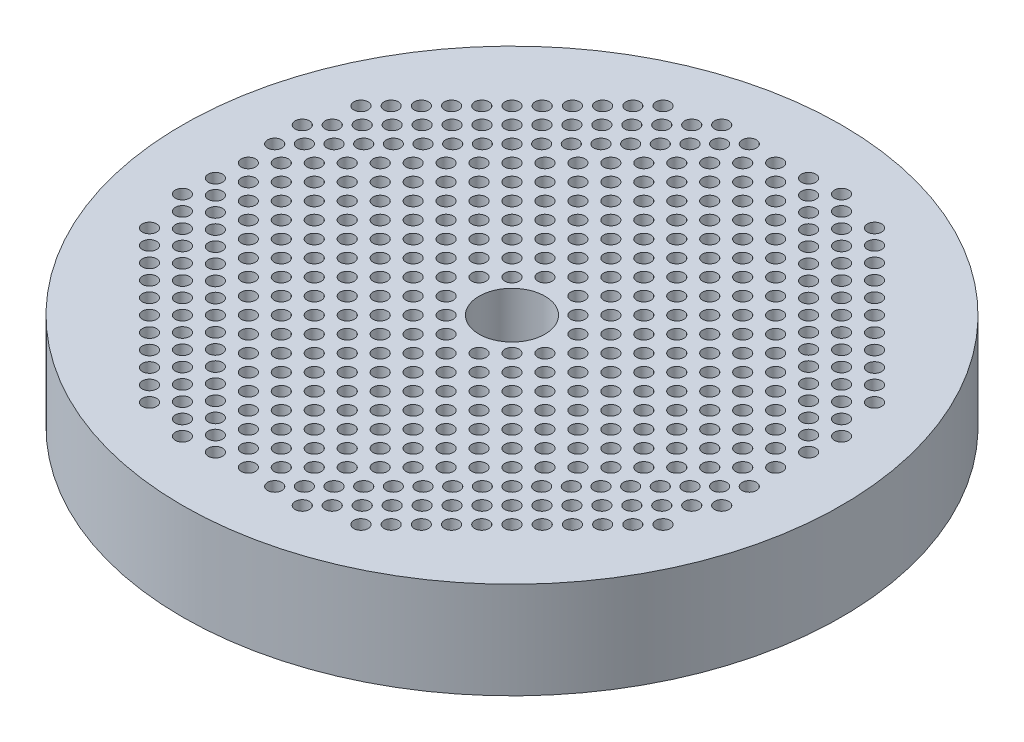
from build123d import *

# Parameters (mm, degrees)
SKETCH1_R               = 150
BOSS_EXTRUDE2_DEPTH     = 22
FILL_START              = -22
FILL_PATTERN1_OUTLINE_R = 3.25
FILL_PATTERN1_DEPTH     = 44


# Read off the part's stored shape, not the designer's step: Fill Pattern1
with BuildPart() as part:
    # Sketch1 → Boss-Extrude2 (new, symmetric)
    # profile 1 of 3: a face of its own
    with BuildSketch(Plane(origin=(0, 0, 0), x_dir=(1, 0, 0), z_dir=(0, 1, 0))):
        with Locations(Location((0, 0, 0), (0, 0, 270))):
            Circle(SKETCH1_R)
        with BuildLine():
            Line((0, -18.3), (-5, -18.3))
            Line((-5, -18.3), (-5, -14.142135623730951))
            ThreePointArc((-5.000000000000001, -14.142135623730951), (-8.660254037844386, 12.24744871391589), (15, 0))
            ThreePointArc((15, -3.67e-15), (12.247448713915892, -8.660254037844384), (4.999999999999996, -14.142135623730953))
            Line((5, -14.142135623730951), (5, -18.3))
            Line((5, -18.3), (0, -18.3))
        make_face(mode=Mode.SUBTRACT)
    # profile 2 of 3: a face of its own
    with BuildSketch(Plane(origin=(0, 0, 0), x_dir=(1, 0, 0), z_dir=(0, 1, 0))):
        with BuildLine():
            Line((0, -15), (0, -18.3))
            Line((0, -18.3), (5, -18.3))
            Line((5, -18.3), (5, -14.142135623730951))
            ThreePointArc((4.999999999999996, -14.142135623730953), (2.5365296808862734, -14.78397839480236), (-3.4915e-13, -15))
        make_face()
    # profile 3 of 3: a face of its own
    with BuildSketch(Plane(origin=(0, 0, 0), x_dir=(1, 0, 0), z_dir=(0, 1, 0))):
        with BuildLine():
            Line((-5, -14.142135623730951), (-5, -18.3))
            Line((-5, -18.3), (0, -18.3))
            Line((0, -18.3), (0, -15))
            ThreePointArc((-3.4915e-13, -15), (-2.5365296808866202, -14.7839783948023), (-5.000000000000001, -14.142135623730951))
        make_face()
    extrude(amount=BOSS_EXTRUDE2_DEPTH, both=True)

    # Fill Pattern1 outline → Fill Pattern1 (cut)
    with BuildSketch(Plane(origin=(0, 0, 0), x_dir=(1, 0, 0), z_dir=(0, 1, 0)).offset(FILL_START)):
        with Locations((0, -29.999996932)):
            Circle(FILL_PATTERN1_OUTLINE_R)
        with Locations((7.5, -82.499996932)):
            Circle(FILL_PATTERN1_OUTLINE_R)
        with Locations((40.5, 94.500003068)):
            Circle(FILL_PATTERN1_OUTLINE_R)
        with Locations((105, 15.000003068)):
            Circle(FILL_PATTERN1_OUTLINE_R)
        with Locations((75, -29.999996932)):
            Circle(FILL_PATTERN1_OUTLINE_R)
        with Locations((15, -74.999996932)):
            Circle(FILL_PATTERN1_OUTLINE_R)
        with Locations((33.75, 101.250003068)):
            Circle(FILL_PATTERN1_OUTLINE_R)
        with Locations((97.5, 22.500003068)):
            Circle(FILL_PATTERN1_OUTLINE_R)
        with Locations((82.5, -22.499996932)):
            Circle(FILL_PATTERN1_OUTLINE_R)
        with Locations((120, 3.068e-06)):
            Circle(FILL_PATTERN1_OUTLINE_R)
        with Locations((54, 81.000003068)):
            Circle(FILL_PATTERN1_OUTLINE_R)
        with Locations((27.272727273, 122.727275795)):
            Circle(FILL_PATTERN1_OUTLINE_R)
        with Locations((52.5, -52.499996932)):
            Circle(FILL_PATTERN1_OUTLINE_R)
        with Locations((60, -44.999996932)):
            Circle(FILL_PATTERN1_OUTLINE_R)
        with Locations((47.25, 87.750003068)):
            Circle(FILL_PATTERN1_OUTLINE_R)
        with Locations((112.5, 7.500003068)):
            Circle(FILL_PATTERN1_OUTLINE_R)
        with Locations((67.5, -37.499996932)):
            Circle(FILL_PATTERN1_OUTLINE_R)
        with Locations((37.5, -52.499996932)):
            Circle(FILL_PATTERN1_OUTLINE_R)
        with Locations((13.5, 121.500003068)):
            Circle(FILL_PATTERN1_OUTLINE_R)
        with Locations((75, 45.000003068)):
            Circle(FILL_PATTERN1_OUTLINE_R)
        with Locations((105, 3.068e-06)):
            Circle(FILL_PATTERN1_OUTLINE_R)
        with Locations((45, -44.999996932)):
            Circle(FILL_PATTERN1_OUTLINE_R)
        with Locations((-48.125, 116.875003068)):
            Circle(FILL_PATTERN1_OUTLINE_R)
        with Locations((67.5, 52.500003068)):
            Circle(FILL_PATTERN1_OUTLINE_R)
        with Locations((97.5, 7.500003068)):
            Circle(FILL_PATTERN1_OUTLINE_R)
        with Locations((22.5, -67.499996932)):
            Circle(FILL_PATTERN1_OUTLINE_R)
        with Locations((27, 108.000003068)):
            Circle(FILL_PATTERN1_OUTLINE_R)
        with Locations((90, 30.000003068)):
            Circle(FILL_PATTERN1_OUTLINE_R)
        with Locations((90, -14.999996932)):
            Circle(FILL_PATTERN1_OUTLINE_R)
        with Locations((30, -59.999996932)):
            Circle(FILL_PATTERN1_OUTLINE_R)
        with Locations((20.25, 114.750003068)):
            Circle(FILL_PATTERN1_OUTLINE_R)
        with Locations((82.5, 37.500003068)):
            Circle(FILL_PATTERN1_OUTLINE_R)
        with Locations((97.5, -7.499996932)):
            Circle(FILL_PATTERN1_OUTLINE_R)
        with Locations((7.5, -97.499996932)):
            Circle(FILL_PATTERN1_OUTLINE_R)
        with Locations((68.181818182, 81.818184886)):
            Circle(FILL_PATTERN1_OUTLINE_R)
        with Locations((94.5, 40.500003068)):
            Circle(FILL_PATTERN1_OUTLINE_R)
        with Locations((75, -44.999996932)):
            Circle(FILL_PATTERN1_OUTLINE_R)
        with Locations((15, -89.999996932)):
            Circle(FILL_PATTERN1_OUTLINE_R)
        with Locations((61.363636364, 88.636366705)):
            Circle(FILL_PATTERN1_OUTLINE_R)
        with Locations((87.75, 47.250003068)):
            Circle(FILL_PATTERN1_OUTLINE_R)
        with Locations((82.5, -37.499996932)):
            Circle(FILL_PATTERN1_OUTLINE_R)
        with Locations((55, 110.000003068)):
            Circle(FILL_PATTERN1_OUTLINE_R)
        with Locations((81.818181818, 68.18182125)):
            Circle(FILL_PATTERN1_OUTLINE_R)
        with Locations((108, 27.000003068)):
            Circle(FILL_PATTERN1_OUTLINE_R)
        with Locations((60, -59.999996932)):
            Circle(FILL_PATTERN1_OUTLINE_R)
        with Locations((48.125, 116.875003068)):
            Circle(FILL_PATTERN1_OUTLINE_R)
        with Locations((75, 75.000003068)):
            Circle(FILL_PATTERN1_OUTLINE_R)
        with Locations((101.25, 33.750003068)):
            Circle(FILL_PATTERN1_OUTLINE_R)
        with Locations((67.5, -52.499996932)):
            Circle(FILL_PATTERN1_OUTLINE_R)
        with Locations((37.5, -67.499996932)):
            Circle(FILL_PATTERN1_OUTLINE_R)
        with Locations((40.909090909, 109.090912159)):
            Circle(FILL_PATTERN1_OUTLINE_R)
        with Locations((67.5, 67.500003068)):
            Circle(FILL_PATTERN1_OUTLINE_R)
        with Locations((105, -14.999996932)):
            Circle(FILL_PATTERN1_OUTLINE_R)
        with Locations((45, -59.999996932)):
            Circle(FILL_PATTERN1_OUTLINE_R)
        with Locations((34.090909091, 115.909093977)):
            Circle(FILL_PATTERN1_OUTLINE_R)
        with Locations((60.75, 74.250003068)):
            Circle(FILL_PATTERN1_OUTLINE_R)
        with Locations((112.5, -7.499996932)):
            Circle(FILL_PATTERN1_OUTLINE_R)
        with Locations((22.5, -82.499996932)):
            Circle(FILL_PATTERN1_OUTLINE_R)
        with Locations((54.545454545, 95.454548523)):
            Circle(FILL_PATTERN1_OUTLINE_R)
        with Locations((81, 54.000003068)):
            Circle(FILL_PATTERN1_OUTLINE_R)
        with Locations((90, -29.999996932)):
            Circle(FILL_PATTERN1_OUTLINE_R)
        with Locations((30, -74.999996932)):
            Circle(FILL_PATTERN1_OUTLINE_R)
        with Locations((47.727272727, 102.272730341)):
            Circle(FILL_PATTERN1_OUTLINE_R)
        with Locations((74.25, 60.750003068)):
            Circle(FILL_PATTERN1_OUTLINE_R)
        with Locations((97.5, -22.499996932)):
            Circle(FILL_PATTERN1_OUTLINE_R)
        with Locations((45, 60.000003068)):
            Circle(FILL_PATTERN1_OUTLINE_R)
        with Locations((75, 15.000003068)):
            Circle(FILL_PATTERN1_OUTLINE_R)
        with Locations((45, -29.999996932)):
            Circle(FILL_PATTERN1_OUTLINE_R)
        with Locations((-103.125, 61.875003068)):
            Circle(FILL_PATTERN1_OUTLINE_R)
        with Locations((15, 105.000003068)):
            Circle(FILL_PATTERN1_OUTLINE_R)
        with Locations((-40.5, 94.500003068)):
            Circle(FILL_PATTERN1_OUTLINE_R)
        with Locations((-68.181818182, 81.818184886)):
            Circle(FILL_PATTERN1_OUTLINE_R)
        with Locations((-96.25, 68.750003068)):
            Circle(FILL_PATTERN1_OUTLINE_R)
        with Locations((30, -44.999996932)):
            Circle(FILL_PATTERN1_OUTLINE_R)
        with Locations((-89.375, 75.625003068)):
            Circle(FILL_PATTERN1_OUTLINE_R)
        with Locations((-61.363636364, 88.636366705)):
            Circle(FILL_PATTERN1_OUTLINE_R)
        with Locations((-33.75, 101.250003068)):
            Circle(FILL_PATTERN1_OUTLINE_R)
        with Locations((22.5, 97.500003068)):
            Circle(FILL_PATTERN1_OUTLINE_R)
        with Locations((52.5, 52.500003068)):
            Circle(FILL_PATTERN1_OUTLINE_R)
        with Locations((82.5, 7.500003068)):
            Circle(FILL_PATTERN1_OUTLINE_R)
        with Locations((37.5, -37.499996932)):
            Circle(FILL_PATTERN1_OUTLINE_R)
        with Locations((-54, 81.000003068)):
            Circle(FILL_PATTERN1_OUTLINE_R)
        with Locations((0, 120.000003068)):
            Circle(FILL_PATTERN1_OUTLINE_R)
        with Locations((30, 75.000003068)):
            Circle(FILL_PATTERN1_OUTLINE_R)
        with Locations((60, 30.000003068)):
            Circle(FILL_PATTERN1_OUTLINE_R)
        with Locations((60, -14.999996932)):
            Circle(FILL_PATTERN1_OUTLINE_R)
        with Locations((-116.875, 48.125003068)):
            Circle(FILL_PATTERN1_OUTLINE_R)
        with Locations((-88.636363636, 61.363639432)):
            Circle(FILL_PATTERN1_OUTLINE_R)
        with Locations((-60.75, 74.250003068)):
            Circle(FILL_PATTERN1_OUTLINE_R)
        with Locations((-75, 75.000003068)):
            Circle(FILL_PATTERN1_OUTLINE_R)
        with Locations((-47.25, 87.750003068)):
            Circle(FILL_PATTERN1_OUTLINE_R)
        with Locations((7.5, 112.500003068)):
            Circle(FILL_PATTERN1_OUTLINE_R)
        with Locations((37.5, 67.500003068)):
            Circle(FILL_PATTERN1_OUTLINE_R)
        with Locations((67.5, 22.500003068)):
            Circle(FILL_PATTERN1_OUTLINE_R)
        with Locations((52.5, -22.499996932)):
            Circle(FILL_PATTERN1_OUTLINE_R)
        with Locations((-110, 55.000003068)):
            Circle(FILL_PATTERN1_OUTLINE_R)
        with Locations((-81.818181818, 68.18182125)):
            Circle(FILL_PATTERN1_OUTLINE_R)
        with Locations((45, 75.000003068)):
            Circle(FILL_PATTERN1_OUTLINE_R)
        with Locations((-13.5, 121.500003068)):
            Circle(FILL_PATTERN1_OUTLINE_R)
        with Locations((-40.909090909, 109.090912159)):
            Circle(FILL_PATTERN1_OUTLINE_R)
        with Locations((-68.75, 96.250003068)):
            Circle(FILL_PATTERN1_OUTLINE_R)
        with Locations((7.5, -67.499996932)):
            Circle(FILL_PATTERN1_OUTLINE_R)
        with Locations((67.5, -22.499996932)):
            Circle(FILL_PATTERN1_OUTLINE_R)
        with Locations((82.5, 22.500003068)):
            Circle(FILL_PATTERN1_OUTLINE_R)
        with Locations((52.5, 67.500003068)):
            Circle(FILL_PATTERN1_OUTLINE_R)
        with Locations((60, 60.000003068)):
            Circle(FILL_PATTERN1_OUTLINE_R)
        with Locations((-27.272727273, 122.727275795)):
            Circle(FILL_PATTERN1_OUTLINE_R)
        with Locations((-55, 110.000003068)):
            Circle(FILL_PATTERN1_OUTLINE_R)
        with Locations((52.5, -37.499996932)):
            Circle(FILL_PATTERN1_OUTLINE_R)
        with Locations((90, 15.000003068)):
            Circle(FILL_PATTERN1_OUTLINE_R)
        with Locations((60, -29.999996932)):
            Circle(FILL_PATTERN1_OUTLINE_R)
        with Locations((-61.875, 103.125003068)):
            Circle(FILL_PATTERN1_OUTLINE_R)
        with Locations((-34.090909091, 115.909093977)):
            Circle(FILL_PATTERN1_OUTLINE_R)
        with Locations((82.5, -7.499996932)):
            Circle(FILL_PATTERN1_OUTLINE_R)
        with Locations((22.5, -52.499996932)):
            Circle(FILL_PATTERN1_OUTLINE_R)
        with Locations((-82.5, 82.500003068)):
            Circle(FILL_PATTERN1_OUTLINE_R)
        with Locations((-54.545454545, 95.454548523)):
            Circle(FILL_PATTERN1_OUTLINE_R)
        with Locations((-27, 108.000003068)):
            Circle(FILL_PATTERN1_OUTLINE_R)
        with Locations((30, 90.000003068)):
            Circle(FILL_PATTERN1_OUTLINE_R)
        with Locations((60, 45.000003068)):
            Circle(FILL_PATTERN1_OUTLINE_R)
        with Locations((90, 3.068e-06)):
            Circle(FILL_PATTERN1_OUTLINE_R)
        with Locations((75, 30.000003068)):
            Circle(FILL_PATTERN1_OUTLINE_R)
        with Locations((75, -14.999996932)):
            Circle(FILL_PATTERN1_OUTLINE_R)
        with Locations((15, -59.999996932)):
            Circle(FILL_PATTERN1_OUTLINE_R)
        with Locations((-75.625, 89.375003068)):
            Circle(FILL_PATTERN1_OUTLINE_R)
        with Locations((-47.727272727, 102.272730341)):
            Circle(FILL_PATTERN1_OUTLINE_R)
        with Locations((-20.25, 114.750003068)):
            Circle(FILL_PATTERN1_OUTLINE_R)
        with Locations((37.5, 82.500003068)):
            Circle(FILL_PATTERN1_OUTLINE_R)
        with Locations((67.5, 37.500003068)):
            Circle(FILL_PATTERN1_OUTLINE_R)
        with Locations((48.125, -116.874996932)):
            Circle(FILL_PATTERN1_OUTLINE_R)
        with Locations((55, -109.999996932)):
            Circle(FILL_PATTERN1_OUTLINE_R)
        with Locations((61.875, -103.124996932)):
            Circle(FILL_PATTERN1_OUTLINE_R)
        with Locations((103.125, 61.875003068)):
            Circle(FILL_PATTERN1_OUTLINE_R)
        with Locations((114.75, -20.249996932)):
            Circle(FILL_PATTERN1_OUTLINE_R)
        with Locations((7.5, -112.499996932)):
            Circle(FILL_PATTERN1_OUTLINE_R)
        with Locations((96.25, 68.750003068)):
            Circle(FILL_PATTERN1_OUTLINE_R)
        with Locations((122.727272727, 27.272730341)):
            Circle(FILL_PATTERN1_OUTLINE_R)
        with Locations((121.5, -13.499996932)):
            Circle(FILL_PATTERN1_OUTLINE_R)
        with Locations((15, -104.999996932)):
            Circle(FILL_PATTERN1_OUTLINE_R)
        with Locations((89.375, 75.625003068)):
            Circle(FILL_PATTERN1_OUTLINE_R)
        with Locations((116.875, 48.125003068)):
            Circle(FILL_PATTERN1_OUTLINE_R)
        with Locations((101.25, -33.749996932)):
            Circle(FILL_PATTERN1_OUTLINE_R)
        with Locations((110, 55.000003068)):
            Circle(FILL_PATTERN1_OUTLINE_R)
        with Locations((108, -26.999996932)):
            Circle(FILL_PATTERN1_OUTLINE_R)
        with Locations((94.5, -40.499996932)):
            Circle(FILL_PATTERN1_OUTLINE_R)
        with Locations((87.75, -47.249996932)):
            Circle(FILL_PATTERN1_OUTLINE_R)
        with Locations((81, -53.999996932)):
            Circle(FILL_PATTERN1_OUTLINE_R)
        with Locations((74.25, -60.749996932)):
            Circle(FILL_PATTERN1_OUTLINE_R)
        with Locations((68.75, 96.250003068)):
            Circle(FILL_PATTERN1_OUTLINE_R)
        with Locations((95.454545455, 54.545457614)):
            Circle(FILL_PATTERN1_OUTLINE_R)
        with Locations((121.5, 13.500003068)):
            Circle(FILL_PATTERN1_OUTLINE_R)
        with Locations((45, -74.999996932)):
            Circle(FILL_PATTERN1_OUTLINE_R)
        with Locations((61.875, 103.125003068)):
            Circle(FILL_PATTERN1_OUTLINE_R)
        with Locations((88.636363636, 61.363639432)):
            Circle(FILL_PATTERN1_OUTLINE_R)
        with Locations((114.75, 20.250003068)):
            Circle(FILL_PATTERN1_OUTLINE_R)
        with Locations((52.5, -67.499996932)):
            Circle(FILL_PATTERN1_OUTLINE_R)
        with Locations((115.909090909, 34.090912159)):
            Circle(FILL_PATTERN1_OUTLINE_R)
        with Locations((22.5, -97.499996932)):
            Circle(FILL_PATTERN1_OUTLINE_R)
        with Locations((82.5, 82.500003068)):
            Circle(FILL_PATTERN1_OUTLINE_R)
        with Locations((109.090909091, 40.909093977)):
            Circle(FILL_PATTERN1_OUTLINE_R)
        with Locations((37.5, -82.499996932)):
            Circle(FILL_PATTERN1_OUTLINE_R)
        with Locations((102.272727273, 47.727275795)):
            Circle(FILL_PATTERN1_OUTLINE_R)
        with Locations((75.625, 89.375003068)):
            Circle(FILL_PATTERN1_OUTLINE_R)
        with Locations((30, -89.999996932)):
            Circle(FILL_PATTERN1_OUTLINE_R)
        with Locations((54.545454545, -95.454542386)):
            Circle(FILL_PATTERN1_OUTLINE_R)
        with Locations((110, -54.999996932)):
            Circle(FILL_PATTERN1_OUTLINE_R)
        with Locations((47.727272727, -102.272724205)):
            Circle(FILL_PATTERN1_OUTLINE_R)
        with Locations((103.125, -61.874996932)):
            Circle(FILL_PATTERN1_OUTLINE_R)
        with Locations((13.5, -121.499996932)):
            Circle(FILL_PATTERN1_OUTLINE_R)
        with Locations((68.181818182, -81.81817875)):
            Circle(FILL_PATTERN1_OUTLINE_R)
        with Locations((61.363636364, -88.636360568)):
            Circle(FILL_PATTERN1_OUTLINE_R)
        with Locations((116.875, -48.124996932)):
            Circle(FILL_PATTERN1_OUTLINE_R)
        with Locations((27.272727273, -122.727269659)):
            Circle(FILL_PATTERN1_OUTLINE_R)
        with Locations((82.5, -82.499996932)):
            Circle(FILL_PATTERN1_OUTLINE_R)
        with Locations((75.625, -89.374996932)):
            Circle(FILL_PATTERN1_OUTLINE_R)
        with Locations((68.75, -96.249996932)):
            Circle(FILL_PATTERN1_OUTLINE_R)
        with Locations((40.909090909, -109.090906023)):
            Circle(FILL_PATTERN1_OUTLINE_R)
        with Locations((96.25, -68.749996932)):
            Circle(FILL_PATTERN1_OUTLINE_R)
        with Locations((34.090909091, -115.909087841)):
            Circle(FILL_PATTERN1_OUTLINE_R)
        with Locations((89.375, -75.624996932)):
            Circle(FILL_PATTERN1_OUTLINE_R)
        with Locations((54, -80.999996932)):
            Circle(FILL_PATTERN1_OUTLINE_R)
        with Locations((109.090909091, -40.909087841)):
            Circle(FILL_PATTERN1_OUTLINE_R)
        with Locations((47.25, -87.749996932)):
            Circle(FILL_PATTERN1_OUTLINE_R)
        with Locations((102.272727273, -47.727269659)):
            Circle(FILL_PATTERN1_OUTLINE_R)
        with Locations((67.5, -67.499996932)):
            Circle(FILL_PATTERN1_OUTLINE_R)
        with Locations((122.727272727, -27.272724205)):
            Circle(FILL_PATTERN1_OUTLINE_R)
        with Locations((60.75, -74.249996932)):
            Circle(FILL_PATTERN1_OUTLINE_R)
        with Locations((115.909090909, -34.090906023)):
            Circle(FILL_PATTERN1_OUTLINE_R)
        with Locations((27, -107.999996932)):
            Circle(FILL_PATTERN1_OUTLINE_R)
        with Locations((81.818181818, -68.181815114)):
            Circle(FILL_PATTERN1_OUTLINE_R)
        with Locations((20.25, -114.749996932)):
            Circle(FILL_PATTERN1_OUTLINE_R)
        with Locations((75, -74.999996932)):
            Circle(FILL_PATTERN1_OUTLINE_R)
        with Locations((40.5, -94.499996932)):
            Circle(FILL_PATTERN1_OUTLINE_R)
        with Locations((95.454545455, -54.545451477)):
            Circle(FILL_PATTERN1_OUTLINE_R)
        with Locations((33.75, -101.249996932)):
            Circle(FILL_PATTERN1_OUTLINE_R)
        with Locations((88.636363636, -61.363633295)):
            Circle(FILL_PATTERN1_OUTLINE_R)
        with Locations((-15, 30.000003068)):
            Circle(FILL_PATTERN1_OUTLINE_R)
        with Locations((15, 15.000003068)):
            Circle(FILL_PATTERN1_OUTLINE_R)
        with Locations((-61.875, -103.124996932)):
            Circle(FILL_PATTERN1_OUTLINE_R)
        with Locations((-61.363636364, -88.636360568)):
            Circle(FILL_PATTERN1_OUTLINE_R)
        with Locations((-60.75, -74.249996932)):
            Circle(FILL_PATTERN1_OUTLINE_R)
        with Locations((-67.5, -52.499996932)):
            Circle(FILL_PATTERN1_OUTLINE_R)
        with Locations((-67.5, -37.499996932)):
            Circle(FILL_PATTERN1_OUTLINE_R)
        with Locations((-67.5, -22.499996932)):
            Circle(FILL_PATTERN1_OUTLINE_R)
        with Locations((-45, 15.000003068)):
            Circle(FILL_PATTERN1_OUTLINE_R)
        with Locations((-75, 3.068e-06)):
            Circle(FILL_PATTERN1_OUTLINE_R)
        with Locations((-75, -14.999996932)):
            Circle(FILL_PATTERN1_OUTLINE_R)
        with Locations((-75, -29.999996932)):
            Circle(FILL_PATTERN1_OUTLINE_R)
        with Locations((-75, -44.999996932)):
            Circle(FILL_PATTERN1_OUTLINE_R)
        with Locations((-67.5, -67.499996932)):
            Circle(FILL_PATTERN1_OUTLINE_R)
        with Locations((-68.181818182, -81.81817875)):
            Circle(FILL_PATTERN1_OUTLINE_R)
        with Locations((-68.75, -96.249996932)):
            Circle(FILL_PATTERN1_OUTLINE_R)
        with Locations((-47.727272727, -102.272724205)):
            Circle(FILL_PATTERN1_OUTLINE_R)
        with Locations((-48.125, -116.874996932)):
            Circle(FILL_PATTERN1_OUTLINE_R)
        with Locations((0, 30.000003068)):
            Circle(FILL_PATTERN1_OUTLINE_R)
        with Locations((-30, 15.000003068)):
            Circle(FILL_PATTERN1_OUTLINE_R)
        with Locations((-60, 3.068e-06)):
            Circle(FILL_PATTERN1_OUTLINE_R)
        with Locations((-60, -14.999996932)):
            Circle(FILL_PATTERN1_OUTLINE_R)
        with Locations((-60, -29.999996932)):
            Circle(FILL_PATTERN1_OUTLINE_R)
        with Locations((-60, -44.999996932)):
            Circle(FILL_PATTERN1_OUTLINE_R)
        with Locations((-60, -59.999996932)):
            Circle(FILL_PATTERN1_OUTLINE_R)
        with Locations((-54, -80.999996932)):
            Circle(FILL_PATTERN1_OUTLINE_R)
        with Locations((-54.545454545, -95.454542386)):
            Circle(FILL_PATTERN1_OUTLINE_R)
        with Locations((-55, -109.999996932)):
            Circle(FILL_PATTERN1_OUTLINE_R)
        with Locations((7.5, 22.500003068)):
            Circle(FILL_PATTERN1_OUTLINE_R)
        with Locations((-22.5, 22.500003068)):
            Circle(FILL_PATTERN1_OUTLINE_R)
        with Locations((-52.5, 7.500003068)):
            Circle(FILL_PATTERN1_OUTLINE_R)
        with Locations((-67.5, -7.499996932)):
            Circle(FILL_PATTERN1_OUTLINE_R)
        with Locations((-90, -29.999996932)):
            Circle(FILL_PATTERN1_OUTLINE_R)
        with Locations((-81, -53.999996932)):
            Circle(FILL_PATTERN1_OUTLINE_R)
        with Locations((-81.818181818, -68.181815114)):
            Circle(FILL_PATTERN1_OUTLINE_R)
        with Locations((-82.5, -82.499996932)):
            Circle(FILL_PATTERN1_OUTLINE_R)
        with Locations((22.5, -7.499996932)):
            Circle(FILL_PATTERN1_OUTLINE_R)
        with Locations((7.5, 37.500003068)):
            Circle(FILL_PATTERN1_OUTLINE_R)
        with Locations((-22.5, 37.500003068)):
            Circle(FILL_PATTERN1_OUTLINE_R)
        with Locations((-52.5, 22.500003068)):
            Circle(FILL_PATTERN1_OUTLINE_R)
        with Locations((15, 30.000003068)):
            Circle(FILL_PATTERN1_OUTLINE_R)
        with Locations((15, -14.999996932)):
            Circle(FILL_PATTERN1_OUTLINE_R)
        with Locations((-89.375, -75.624996932)):
            Circle(FILL_PATTERN1_OUTLINE_R)
        with Locations((-88.636363636, -61.363633295)):
            Circle(FILL_PATTERN1_OUTLINE_R)
        with Locations((-87.75, -47.249996932)):
            Circle(FILL_PATTERN1_OUTLINE_R)
        with Locations((-97.5, -22.499996932)):
            Circle(FILL_PATTERN1_OUTLINE_R)
        with Locations((-97.5, -7.499996932)):
            Circle(FILL_PATTERN1_OUTLINE_R)
        with Locations((-82.5, 7.500003068)):
            Circle(FILL_PATTERN1_OUTLINE_R)
        with Locations((22.5, 7.500003068)):
            Circle(FILL_PATTERN1_OUTLINE_R)
        with Locations((-7.5, 37.500003068)):
            Circle(FILL_PATTERN1_OUTLINE_R)
        with Locations((-37.5, 22.500003068)):
            Circle(FILL_PATTERN1_OUTLINE_R)
        with Locations((-67.5, 7.500003068)):
            Circle(FILL_PATTERN1_OUTLINE_R)
        with Locations((-82.5, -7.499996932)):
            Circle(FILL_PATTERN1_OUTLINE_R)
        with Locations((-82.5, -22.499996932)):
            Circle(FILL_PATTERN1_OUTLINE_R)
        with Locations((-82.5, -37.499996932)):
            Circle(FILL_PATTERN1_OUTLINE_R)
        with Locations((-74.25, -60.749996932)):
            Circle(FILL_PATTERN1_OUTLINE_R)
        with Locations((-90, -14.999996932)):
            Circle(FILL_PATTERN1_OUTLINE_R)
        with Locations((-90, 3.068e-06)):
            Circle(FILL_PATTERN1_OUTLINE_R)
        with Locations((-60, 15.000003068)):
            Circle(FILL_PATTERN1_OUTLINE_R)
        with Locations((-30, 30.000003068)):
            Circle(FILL_PATTERN1_OUTLINE_R)
        with Locations((0, 45.000003068)):
            Circle(FILL_PATTERN1_OUTLINE_R)
        with Locations((30, 3.068e-06)):
            Circle(FILL_PATTERN1_OUTLINE_R)
        with Locations((-75.625, -89.374996932)):
            Circle(FILL_PATTERN1_OUTLINE_R)
        with Locations((-75, -74.999996932)):
            Circle(FILL_PATTERN1_OUTLINE_R)
        with Locations((-13.5, -121.499996932)):
            Circle(FILL_PATTERN1_OUTLINE_R)
        with Locations((-22.5, -7.499996932)):
            Circle(FILL_PATTERN1_OUTLINE_R)
        with Locations((-22.5, -22.499996932)):
            Circle(FILL_PATTERN1_OUTLINE_R)
        with Locations((-22.5, -37.499996932)):
            Circle(FILL_PATTERN1_OUTLINE_R)
        with Locations((-15, -104.999996932)):
            Circle(FILL_PATTERN1_OUTLINE_R)
        with Locations((-15, -89.999996932)):
            Circle(FILL_PATTERN1_OUTLINE_R)
        with Locations((-15, -74.999996932)):
            Circle(FILL_PATTERN1_OUTLINE_R)
        with Locations((-15, -59.999996932)):
            Circle(FILL_PATTERN1_OUTLINE_R)
        with Locations((-20.25, -114.749996932)):
            Circle(FILL_PATTERN1_OUTLINE_R)
        with Locations((-30, 3.068e-06)):
            Circle(FILL_PATTERN1_OUTLINE_R)
        with Locations((-30, -14.999996932)):
            Circle(FILL_PATTERN1_OUTLINE_R)
        with Locations((-30, -29.999996932)):
            Circle(FILL_PATTERN1_OUTLINE_R)
        with Locations((-22.5, -97.499996932)):
            Circle(FILL_PATTERN1_OUTLINE_R)
        with Locations((-22.5, -82.499996932)):
            Circle(FILL_PATTERN1_OUTLINE_R)
        with Locations((-22.5, -67.499996932)):
            Circle(FILL_PATTERN1_OUTLINE_R)
        with Locations((-22.5, -52.499996932)):
            Circle(FILL_PATTERN1_OUTLINE_R)
        with Locations((-7.5, -37.499996932)):
            Circle(FILL_PATTERN1_OUTLINE_R)
        with Locations((-7.5, -22.499996932)):
            Circle(FILL_PATTERN1_OUTLINE_R)
        with Locations((0, -119.999996932)):
            Circle(FILL_PATTERN1_OUTLINE_R)
        with Locations((0, -104.999996932)):
            Circle(FILL_PATTERN1_OUTLINE_R)
        with Locations((0, -89.999996932)):
            Circle(FILL_PATTERN1_OUTLINE_R)
        with Locations((0, -74.999996932)):
            Circle(FILL_PATTERN1_OUTLINE_R)
        with Locations((0, -59.999996932)):
            Circle(FILL_PATTERN1_OUTLINE_R)
        with Locations((0, -44.999996932)):
            Circle(FILL_PATTERN1_OUTLINE_R)
        with Locations((-7.5, -112.499996932)):
            Circle(FILL_PATTERN1_OUTLINE_R)
        with Locations((-15, -14.999996932)):
            Circle(FILL_PATTERN1_OUTLINE_R)
        with Locations((-15, -29.999996932)):
            Circle(FILL_PATTERN1_OUTLINE_R)
        with Locations((-15, -44.999996932)):
            Circle(FILL_PATTERN1_OUTLINE_R)
        with Locations((-7.5, -97.499996932)):
            Circle(FILL_PATTERN1_OUTLINE_R)
        with Locations((-7.5, -82.499996932)):
            Circle(FILL_PATTERN1_OUTLINE_R)
        with Locations((-7.5, -67.499996932)):
            Circle(FILL_PATTERN1_OUTLINE_R)
        with Locations((-7.5, -52.499996932)):
            Circle(FILL_PATTERN1_OUTLINE_R)
        with Locations((-45, 3.068e-06)):
            Circle(FILL_PATTERN1_OUTLINE_R)
        with Locations((-45, -14.999996932)):
            Circle(FILL_PATTERN1_OUTLINE_R)
        with Locations((-45, -29.999996932)):
            Circle(FILL_PATTERN1_OUTLINE_R)
        with Locations((-45, -44.999996932)):
            Circle(FILL_PATTERN1_OUTLINE_R)
        with Locations((-45, -59.999996932)):
            Circle(FILL_PATTERN1_OUTLINE_R)
        with Locations((-45, -74.999996932)):
            Circle(FILL_PATTERN1_OUTLINE_R)
        with Locations((-40.5, -94.499996932)):
            Circle(FILL_PATTERN1_OUTLINE_R)
        with Locations((-40.909090909, -109.090906023)):
            Circle(FILL_PATTERN1_OUTLINE_R)
        with Locations((-7.5, 22.500003068)):
            Circle(FILL_PATTERN1_OUTLINE_R)
        with Locations((-37.5, 7.500003068)):
            Circle(FILL_PATTERN1_OUTLINE_R)
        with Locations((-52.5, -7.499996932)):
            Circle(FILL_PATTERN1_OUTLINE_R)
        with Locations((-52.5, -22.499996932)):
            Circle(FILL_PATTERN1_OUTLINE_R)
        with Locations((-52.5, -37.499996932)):
            Circle(FILL_PATTERN1_OUTLINE_R)
        with Locations((-52.5, -52.499996932)):
            Circle(FILL_PATTERN1_OUTLINE_R)
        with Locations((-52.5, -67.499996932)):
            Circle(FILL_PATTERN1_OUTLINE_R)
        with Locations((-47.25, -87.749996932)):
            Circle(FILL_PATTERN1_OUTLINE_R)
        with Locations((-37.5, -7.499996932)):
            Circle(FILL_PATTERN1_OUTLINE_R)
        with Locations((-22.5, 7.500003068)):
            Circle(FILL_PATTERN1_OUTLINE_R)
        with Locations((-27.272727273, -122.727269659)):
            Circle(FILL_PATTERN1_OUTLINE_R)
        with Locations((-27, -107.999996932)):
            Circle(FILL_PATTERN1_OUTLINE_R)
        with Locations((-30, -89.999996932)):
            Circle(FILL_PATTERN1_OUTLINE_R)
        with Locations((-30, -74.999996932)):
            Circle(FILL_PATTERN1_OUTLINE_R)
        with Locations((-30, -59.999996932)):
            Circle(FILL_PATTERN1_OUTLINE_R)
        with Locations((-30, -44.999996932)):
            Circle(FILL_PATTERN1_OUTLINE_R)
        with Locations((-37.5, -82.499996932)):
            Circle(FILL_PATTERN1_OUTLINE_R)
        with Locations((-33.75, -101.249996932)):
            Circle(FILL_PATTERN1_OUTLINE_R)
        with Locations((-34.090909091, -115.909087841)):
            Circle(FILL_PATTERN1_OUTLINE_R)
        with Locations((-15, 15.000003068)):
            Circle(FILL_PATTERN1_OUTLINE_R)
        with Locations((-37.5, -67.499996932)):
            Circle(FILL_PATTERN1_OUTLINE_R)
        with Locations((-37.5, -52.499996932)):
            Circle(FILL_PATTERN1_OUTLINE_R)
        with Locations((-37.5, -37.499996932)):
            Circle(FILL_PATTERN1_OUTLINE_R)
        with Locations((-37.5, -22.499996932)):
            Circle(FILL_PATTERN1_OUTLINE_R)
        with Locations((-101.25, 33.750003068)):
            Circle(FILL_PATTERN1_OUTLINE_R)
        with Locations((-52.5, 67.500003068)):
            Circle(FILL_PATTERN1_OUTLINE_R)
        with Locations((-22.5, 82.500003068)):
            Circle(FILL_PATTERN1_OUTLINE_R)
        with Locations((7.5, 82.500003068)):
            Circle(FILL_PATTERN1_OUTLINE_R)
        with Locations((37.5, 37.500003068)):
            Circle(FILL_PATTERN1_OUTLINE_R)
        with Locations((52.5, -7.499996932)):
            Circle(FILL_PATTERN1_OUTLINE_R)
        with Locations((-108, 27.000003068)):
            Circle(FILL_PATTERN1_OUTLINE_R)
        with Locations((-60, 60.000003068)):
            Circle(FILL_PATTERN1_OUTLINE_R)
        with Locations((37.5, -22.499996932)):
            Circle(FILL_PATTERN1_OUTLINE_R)
        with Locations((-122.727272727, 27.272730341)):
            Circle(FILL_PATTERN1_OUTLINE_R)
        with Locations((-94.5, 40.500003068)):
            Circle(FILL_PATTERN1_OUTLINE_R)
        with Locations((-45, 75.000003068)):
            Circle(FILL_PATTERN1_OUTLINE_R)
        with Locations((-15, 90.000003068)):
            Circle(FILL_PATTERN1_OUTLINE_R)
        with Locations((15, 75.000003068)):
            Circle(FILL_PATTERN1_OUTLINE_R)
        with Locations((45, 30.000003068)):
            Circle(FILL_PATTERN1_OUTLINE_R)
        with Locations((45, -14.999996932)):
            Circle(FILL_PATTERN1_OUTLINE_R)
        with Locations((22.5, 52.500003068)):
            Circle(FILL_PATTERN1_OUTLINE_R)
        with Locations((52.5, 7.500003068)):
            Circle(FILL_PATTERN1_OUTLINE_R)
        with Locations((7.5, -37.499996932)):
            Circle(FILL_PATTERN1_OUTLINE_R)
        with Locations((-121.5, 13.500003068)):
            Circle(FILL_PATTERN1_OUTLINE_R)
        with Locations((-75, 45.000003068)):
            Circle(FILL_PATTERN1_OUTLINE_R)
        with Locations((-45, 60.000003068)):
            Circle(FILL_PATTERN1_OUTLINE_R)
        with Locations((-15, 75.000003068)):
            Circle(FILL_PATTERN1_OUTLINE_R)
        with Locations((15, 60.000003068)):
            Circle(FILL_PATTERN1_OUTLINE_R)
        with Locations((-30, 75.000003068)):
            Circle(FILL_PATTERN1_OUTLINE_R)
        with Locations((0, 90.000003068)):
            Circle(FILL_PATTERN1_OUTLINE_R)
        with Locations((30, 45.000003068)):
            Circle(FILL_PATTERN1_OUTLINE_R)
        with Locations((60, 3.068e-06)):
            Circle(FILL_PATTERN1_OUTLINE_R)
        with Locations((-114.75, 20.250003068)):
            Circle(FILL_PATTERN1_OUTLINE_R)
        with Locations((-67.5, 52.500003068)):
            Circle(FILL_PATTERN1_OUTLINE_R)
        with Locations((-37.5, 67.500003068)):
            Circle(FILL_PATTERN1_OUTLINE_R)
        with Locations((-7.5, 82.500003068)):
            Circle(FILL_PATTERN1_OUTLINE_R)
        with Locations((7.5, 97.500003068)):
            Circle(FILL_PATTERN1_OUTLINE_R)
        with Locations((-22.5, 97.500003068)):
            Circle(FILL_PATTERN1_OUTLINE_R)
        with Locations((-74.25, 60.750003068)):
            Circle(FILL_PATTERN1_OUTLINE_R)
        with Locations((-102.272727273, 47.727275795)):
            Circle(FILL_PATTERN1_OUTLINE_R)
        with Locations((15, -44.999996932)):
            Circle(FILL_PATTERN1_OUTLINE_R)
        with Locations((75, 3.068e-06)):
            Circle(FILL_PATTERN1_OUTLINE_R)
        with Locations((45, 45.000003068)):
            Circle(FILL_PATTERN1_OUTLINE_R)
        with Locations((15, 90.000003068)):
            Circle(FILL_PATTERN1_OUTLINE_R)
        with Locations((-7.5, 112.500003068)):
            Circle(FILL_PATTERN1_OUTLINE_R)
        with Locations((22.5, 82.500003068)):
            Circle(FILL_PATTERN1_OUTLINE_R)
        with Locations((52.5, 37.500003068)):
            Circle(FILL_PATTERN1_OUTLINE_R)
        with Locations((67.5, -7.499996932)):
            Circle(FILL_PATTERN1_OUTLINE_R)
        with Locations((7.5, -52.499996932)):
            Circle(FILL_PATTERN1_OUTLINE_R)
        with Locations((-95.454545455, 54.545457614)):
            Circle(FILL_PATTERN1_OUTLINE_R)
        with Locations((-67.5, 67.500003068)):
            Circle(FILL_PATTERN1_OUTLINE_R)
        with Locations((-15, 105.000003068)):
            Circle(FILL_PATTERN1_OUTLINE_R)
        with Locations((60, 15.000003068)):
            Circle(FILL_PATTERN1_OUTLINE_R)
        with Locations((30, -29.999996932)):
            Circle(FILL_PATTERN1_OUTLINE_R)
        with Locations((-115.909090909, 34.090912159)):
            Circle(FILL_PATTERN1_OUTLINE_R)
        with Locations((-87.75, 47.250003068)):
            Circle(FILL_PATTERN1_OUTLINE_R)
        with Locations((-37.5, 82.500003068)):
            Circle(FILL_PATTERN1_OUTLINE_R)
        with Locations((-7.5, 97.500003068)):
            Circle(FILL_PATTERN1_OUTLINE_R)
        with Locations((22.5, 67.500003068)):
            Circle(FILL_PATTERN1_OUTLINE_R)
        with Locations((52.5, 22.500003068)):
            Circle(FILL_PATTERN1_OUTLINE_R)
        with Locations((37.5, 52.500003068)):
            Circle(FILL_PATTERN1_OUTLINE_R)
        with Locations((67.5, 7.500003068)):
            Circle(FILL_PATTERN1_OUTLINE_R)
        with Locations((22.5, -37.499996932)):
            Circle(FILL_PATTERN1_OUTLINE_R)
        with Locations((-109.090909091, 40.909093977)):
            Circle(FILL_PATTERN1_OUTLINE_R)
        with Locations((-81, 54.000003068)):
            Circle(FILL_PATTERN1_OUTLINE_R)
        with Locations((-30, 90.000003068)):
            Circle(FILL_PATTERN1_OUTLINE_R)
        with Locations((0, 105.000003068)):
            Circle(FILL_PATTERN1_OUTLINE_R)
        with Locations((30, 60.000003068)):
            Circle(FILL_PATTERN1_OUTLINE_R)
        with Locations((-120, 3.068e-06)):
            Circle(FILL_PATTERN1_OUTLINE_R)
        with Locations((-90, 15.000003068)):
            Circle(FILL_PATTERN1_OUTLINE_R)
        with Locations((-60, 30.000003068)):
            Circle(FILL_PATTERN1_OUTLINE_R)
        with Locations((-30, 45.000003068)):
            Circle(FILL_PATTERN1_OUTLINE_R)
        with Locations((0, 60.000003068)):
            Circle(FILL_PATTERN1_OUTLINE_R)
        with Locations((30, 15.000003068)):
            Circle(FILL_PATTERN1_OUTLINE_R)
        with Locations((-103.125, -61.874996932)):
            Circle(FILL_PATTERN1_OUTLINE_R)
        with Locations((-102.272727273, -47.727269659)):
            Circle(FILL_PATTERN1_OUTLINE_R)
        with Locations((37.5, 7.500003068)):
            Circle(FILL_PATTERN1_OUTLINE_R)
        with Locations((-110, -54.999996932)):
            Circle(FILL_PATTERN1_OUTLINE_R)
        with Locations((-109.090909091, -40.909087841)):
            Circle(FILL_PATTERN1_OUTLINE_R)
        with Locations((-108, -26.999996932)):
            Circle(FILL_PATTERN1_OUTLINE_R)
        with Locations((7.5, 52.500003068)):
            Circle(FILL_PATTERN1_OUTLINE_R)
        with Locations((-22.5, 52.500003068)):
            Circle(FILL_PATTERN1_OUTLINE_R)
        with Locations((-52.5, 37.500003068)):
            Circle(FILL_PATTERN1_OUTLINE_R)
        with Locations((-82.5, 22.500003068)):
            Circle(FILL_PATTERN1_OUTLINE_R)
        with Locations((-15, 45.000003068)):
            Circle(FILL_PATTERN1_OUTLINE_R)
        with Locations((-45, 30.000003068)):
            Circle(FILL_PATTERN1_OUTLINE_R)
        with Locations((-75, 15.000003068)):
            Circle(FILL_PATTERN1_OUTLINE_R)
        with Locations((-105, 3.068e-06)):
            Circle(FILL_PATTERN1_OUTLINE_R)
        with Locations((-105, -14.999996932)):
            Circle(FILL_PATTERN1_OUTLINE_R)
        with Locations((-94.5, -40.499996932)):
            Circle(FILL_PATTERN1_OUTLINE_R)
        with Locations((-95.454545455, -54.545451477)):
            Circle(FILL_PATTERN1_OUTLINE_R)
        with Locations((-96.25, -68.749996932)):
            Circle(FILL_PATTERN1_OUTLINE_R)
        with Locations((7.5, -22.499996932)):
            Circle(FILL_PATTERN1_OUTLINE_R)
        with Locations((22.5, 22.500003068)):
            Circle(FILL_PATTERN1_OUTLINE_R)
        with Locations((-7.5, 52.500003068)):
            Circle(FILL_PATTERN1_OUTLINE_R)
        with Locations((-37.5, 37.500003068)):
            Circle(FILL_PATTERN1_OUTLINE_R)
        with Locations((-67.5, 22.500003068)):
            Circle(FILL_PATTERN1_OUTLINE_R)
        with Locations((-97.5, 7.500003068)):
            Circle(FILL_PATTERN1_OUTLINE_R)
        with Locations((-112.5, -7.499996932)):
            Circle(FILL_PATTERN1_OUTLINE_R)
        with Locations((-101.25, -33.749996932)):
            Circle(FILL_PATTERN1_OUTLINE_R)
        with Locations((-90, 30.000003068)):
            Circle(FILL_PATTERN1_OUTLINE_R)
        with Locations((-60, 45.000003068)):
            Circle(FILL_PATTERN1_OUTLINE_R)
        with Locations((-30, 60.000003068)):
            Circle(FILL_PATTERN1_OUTLINE_R)
        with Locations((0, 75.000003068)):
            Circle(FILL_PATTERN1_OUTLINE_R)
        with Locations((30, 30.000003068)):
            Circle(FILL_PATTERN1_OUTLINE_R)
        with Locations((30, -14.999996932)):
            Circle(FILL_PATTERN1_OUTLINE_R)
        with Locations((-97.5, 22.500003068)):
            Circle(FILL_PATTERN1_OUTLINE_R)
        with Locations((-67.5, 37.500003068)):
            Circle(FILL_PATTERN1_OUTLINE_R)
        with Locations((45, 15.000003068)):
            Circle(FILL_PATTERN1_OUTLINE_R)
        with Locations((15, -29.999996932)):
            Circle(FILL_PATTERN1_OUTLINE_R)
        with Locations((-82.5, 37.500003068)):
            Circle(FILL_PATTERN1_OUTLINE_R)
        with Locations((-52.5, 52.500003068)):
            Circle(FILL_PATTERN1_OUTLINE_R)
        with Locations((-22.5, 67.500003068)):
            Circle(FILL_PATTERN1_OUTLINE_R)
        with Locations((7.5, 67.500003068)):
            Circle(FILL_PATTERN1_OUTLINE_R)
        with Locations((37.5, 22.500003068)):
            Circle(FILL_PATTERN1_OUTLINE_R)
        with Locations((22.5, -22.499996932)):
            Circle(FILL_PATTERN1_OUTLINE_R)
        with Locations((-112.5, 7.500003068)):
            Circle(FILL_PATTERN1_OUTLINE_R)
        with Locations((-114.75, -20.249996932)):
            Circle(FILL_PATTERN1_OUTLINE_R)
        with Locations((-115.909090909, -34.090906023)):
            Circle(FILL_PATTERN1_OUTLINE_R)
        with Locations((-116.875, -48.124996932)):
            Circle(FILL_PATTERN1_OUTLINE_R)
        with Locations((45, 3.068e-06)):
            Circle(FILL_PATTERN1_OUTLINE_R)
        with Locations((15, 45.000003068)):
            Circle(FILL_PATTERN1_OUTLINE_R)
        with Locations((-15, 60.000003068)):
            Circle(FILL_PATTERN1_OUTLINE_R)
        with Locations((-45, 45.000003068)):
            Circle(FILL_PATTERN1_OUTLINE_R)
        with Locations((-75, 30.000003068)):
            Circle(FILL_PATTERN1_OUTLINE_R)
        with Locations((-105, 15.000003068)):
            Circle(FILL_PATTERN1_OUTLINE_R)
        with Locations((-121.5, -13.499996932)):
            Circle(FILL_PATTERN1_OUTLINE_R)
        with Locations((-122.727272727, -27.272724205)):
            Circle(FILL_PATTERN1_OUTLINE_R)
        with Locations((37.5, -7.499996932)):
            Circle(FILL_PATTERN1_OUTLINE_R)
        with Locations((22.5, 37.500003068)):
            Circle(FILL_PATTERN1_OUTLINE_R)
        with Locations((-7.5, 67.500003068)):
            Circle(FILL_PATTERN1_OUTLINE_R)
        with Locations((-37.5, 52.500003068)):
            Circle(FILL_PATTERN1_OUTLINE_R)
    extrude(amount=FILL_PATTERN1_DEPTH, mode=Mode.SUBTRACT)


solid = part.part
